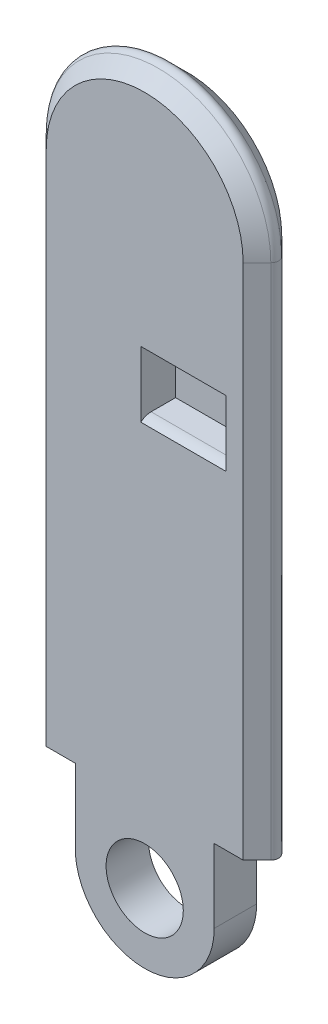
from build123d import *

# Parameters (mm, degrees)
DODANIE_WYCI_GNI_CIE1_DEPTH = 6
SFAZOWANIE1_SIZE            = 3.5
ZAOKR_GLENIE1_R             = 1
SZKIC2_W                    = 11
SZKIC2_H                    = 5.5
WYTNIJ_WYCI_GNI_CIE1_DEPTH  = 5
SZKIC3_W                    = 9
SZKIC3_H                    = 6.5
WYTNIJ_WYCI_GNI_CIE2_DEPTH  = 4.5
SFAZOWANIE2_SIZE            = 0.5
SZKIC4_R                    = 5
DODANIE_WYCI_GNI_CIE2_DEPTH = 6
SZKIC5_W                    = 4
SZKIC5_H                    = 6
DODANIE_WYCI_GNI_CIE3_DEPTH = 4.5
SFAZOWANIE3_SIZE            = 3
SFAZOWANIE4_SIZE            = 1
ZAOKR_GLENIE2_R             = 2
SZKIC6_W                    = 43.68114346
SZKIC6_H                    = 110.382920914
WYTNIJ_WYCI_GNI_CIE3_DEPTH  = 0.5


with BuildPart() as part:
    # Szkic1 → Dodanie-wyciągnięcie1 (new body)
    with BuildSketch(Plane.XY):
        with BuildLine():
            ThreePointArc((15.75, 33.5), (0, 49.25), (-15.75, 33.5))
            Line((-15.75, 33.5), (15.75, 33.5))
        make_face()
        with BuildLine():
            Line((15.75, 33.5), (-15.75, 33.5))
            ThreePointArc((-15.75, 33.5), (0, 17.75), (15.75, 33.5))
        make_face()
        with BuildLine():
            ThreePointArc((15.75, 33.5), (0, 17.75), (-15.75, 33.5))
            Line((-15.75, 33.5), (-15.75, -33.5))
            Line((-15.75, -33.5), (15.75, -33.5))
            Line((15.75, -33.5), (15.75, 33.5))
        make_face()
    extrude(amount=-DODANIE_WYCI_GNI_CIE1_DEPTH)

    # Sfazowanie1
    # the kernel refuses this chamfer: 3.5 mm, written as the material it takes off along each edge
    with BuildSketch(Plane(origin=(15.75, -42.500890458, 0), x_dir=(-0.9996219169112968, 0, 0.02749587661058637), z_dir=(0, 1, 0)), Plane(origin=(-15.75, 33.5, 0), x_dir=(0.9996219169112968, 0, 0.02749587661058637), z_dir=(0, -1, 0)), Plane(origin=(-15.75, 33.5, -6), x_dir=(-0.02749587661058661, 0, 0.9996219169112968), z_dir=(0, -1, 0))) as sfazowanie1_piece_1:
        Polygon((SFAZOWANIE1_SIZE * 0.999621916911, -SFAZOWANIE1_SIZE * 0.0274958766106), (-SFAZOWANIE1_SIZE * 0.0274958766106, -SFAZOWANIE1_SIZE * 0.999621916911), (0, 0), align=None)
    extrude(amount=76.000890458, mode=Mode.SUBTRACT)
    with BuildSketch(Plane(origin=(15.75, -42.500890458, -6), x_dir=(-0.9996219169112968, 0, -0.027495876610586358), z_dir=(0, 1, 0))) as sfazowanie1_piece_2:
        Polygon((SFAZOWANIE1_SIZE * 0.999621916911, SFAZOWANIE1_SIZE * 0.0274958766106), (-SFAZOWANIE1_SIZE * 0.0274958766106, SFAZOWANIE1_SIZE * 0.999621916911), (0, 0), align=None)
    extrude(amount=76.000890458, mode=Mode.SUBTRACT)
    with BuildSketch(Plane(origin=(0, 33.5, 0), x_dir=(-1, 0, 0), z_dir=(0, -1, 0))) as sfazowanie1_piece_3:
        Polygon((15.75, SFAZOWANIE1_SIZE), (15.75 - SFAZOWANIE1_SIZE, 0), (15.75, 0), align=None)
    revolve(axis=Axis((0, 33.5, 0), (0, 0, -1)), revolution_arc=180, mode=Mode.SUBTRACT)
    with BuildSketch(Plane(origin=(0, 33.5, -6), x_dir=(1, 0, 0), z_dir=(0, -1, 0))) as sfazowanie1_piece_4:
        Polygon((15.75, SFAZOWANIE1_SIZE), (15.75 - SFAZOWANIE1_SIZE, 0), (15.75, 0), align=None)
    revolve(axis=Axis((0, 33.5, -6), (0, 0, 1)), revolution_arc=180, mode=Mode.SUBTRACT)

    # Zaokrąglenie1
    zaokr_glenie1_edges = [part.edges().sort_by_distance(p)[0] for p in [
        (-15.25, 0, -3),
        (0, 48.75, -3),
        (15.25, 0, -3),
    ]]
    fillet(zaokr_glenie1_edges, radius=ZAOKR_GLENIE1_R)

    # Szkic2 → Wytnij-wyciągnięcie1 (cut)
    with BuildSketch(Plane.XY):
        with Locations((5, 12.25)):
            Rectangle(SZKIC2_W, SZKIC2_H)
    extrude(amount=-WYTNIJ_WYCI_GNI_CIE1_DEPTH, mode=Mode.SUBTRACT)

    # Szkic3 → Wytnij-wyciągnięcie2 (cut)
    with BuildSketch(Plane(origin=(0, 0, -6), x_dir=(-1, 0, 0), z_dir=(0, 0, -1))):
        with Locations((6, -1.988867336)):
            Rectangle(SZKIC3_W, SZKIC3_H)
        with Locations((6, -27.988867336)):
            Rectangle(SZKIC3_W, SZKIC3_H)
    extrude(amount=-WYTNIJ_WYCI_GNI_CIE2_DEPTH, mode=Mode.SUBTRACT)

    # Sfazowanie2
    sfazowanie2_edges = [part.edges().sort_by_distance(p)[0] for p in [
        (-6, -24.738867336, -6),
    ]]
    chamfer(sfazowanie2_edges, length=SFAZOWANIE2_SIZE)

    # Szkic4 → Dodanie-wyciągnięcie2 (add)
    with BuildSketch(Plane.XY):
        with BuildLine():
            Line((9, -33.5), (-8.974684649, -33.5))
            Line((-8.974684649, -33.5), (-8.974684649, -43.705386779))
            ThreePointArc((-8.974684649, -43.705386779), (0.337519003, -52.024492564), (9, -43.030823629))
            Line((9, -43.030823629), (9, -33.5))
        make_face()
        with Locations((0, -43.030823629)):
            Circle(SZKIC4_R, mode=Mode.SUBTRACT)
    extrude(amount=-DODANIE_WYCI_GNI_CIE2_DEPTH)

    # Szkic5 → Dodanie-wyciągnięcie3 (add)
    with BuildSketch(Plane(origin=(0, 0, -6), x_dir=(-1, 0, 0), z_dir=(0, 0, -1))):
        with Locations((-2.5, 12)):
            Rectangle(SZKIC5_W, SZKIC5_H)
    extrude(amount=DODANIE_WYCI_GNI_CIE3_DEPTH)

    # Sfazowanie3
    sfazowanie3_edges = [part.edges().sort_by_distance(p)[0] for p in [
        (5, 15, 0),
    ]]
    chamfer(sfazowanie3_edges, length=SFAZOWANIE3_SIZE)

    # Sfazowanie4
    sfazowanie4_edges = [part.edges().sort_by_distance(p)[0] for p in [
        (5, 9.5, 0),
    ]]
    chamfer(sfazowanie4_edges, length=SFAZOWANIE4_SIZE)

    # Zaokrąglenie2
    zaokr_glenie2_edges = [part.edges().sort_by_distance(p)[0] for p in [
        (5, 9.5, -1),
    ]]
    fillet(zaokr_glenie2_edges, radius=ZAOKR_GLENIE2_R)

    # Szkic6 → Wytnij-wyciągnięcie3 (cut)
    with BuildSketch(Plane.XY):
        Rectangle(SZKIC6_W, SZKIC6_H)
    extrude(amount=-WYTNIJ_WYCI_GNI_CIE3_DEPTH, mode=Mode.SUBTRACT)


solid = part.part
